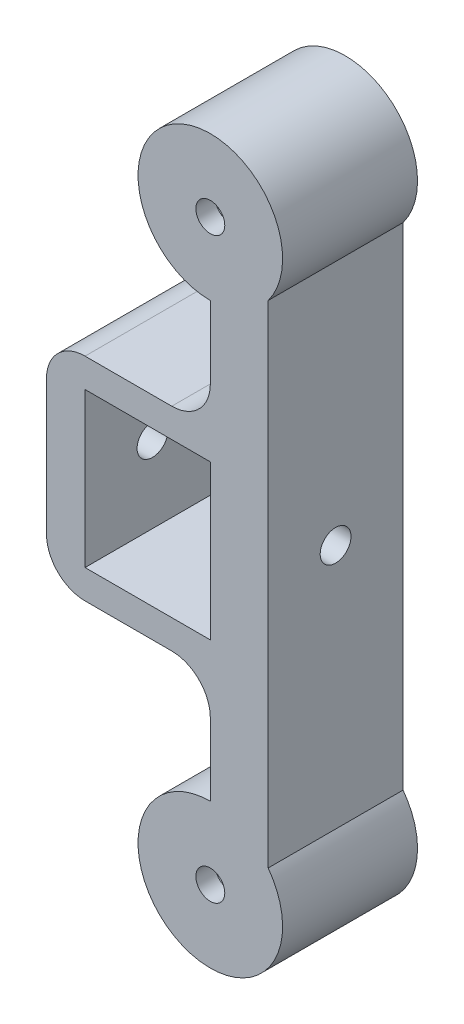
from build123d import *

# Parameters (mm, degrees)
ESBO_O1_R                  = 4
ESBO_O1_W                  = 13
ESBO_O1_H                  = 16
RESSALTO_EXTRUS_O1_DEPTH   = 14
RESSALTO_EXTRUS_O2_START   = -4
ESBO_O3_R                  = 1.5
RESSALTO_EXTRUS_O2_DEPTH   = 4
CORTE_EXTRUS_O1_DEPTH      = 72.001760542
CORTE_EXTRUS_O1_DEPTH_BACK = 72.001760542
ESBO_O2_R                  = 1.6
CORTE_EXTRUS_O2_START      = -2
CORTE_EXTRUS_O2_DEPTH      = 2
FILETE1_R                  = 4


with BuildPart() as part:
    # Esboço1 → Ressalto-extrusão1 (new body)
    with BuildSketch(Plane.XY):
        with BuildLine():
            Line((6, 55.5), (6, 4.5))
            ThreePointArc((6, 4.5), (-3.354101966, -6.708203932), (0, 7.5))
            Line((0, 7.5), (0, 19))
            Line((0, 19), (-17, 19))
            Line((-17, 19), (-17, 41))
            Line((-17, 41), (0, 41))
            Line((0, 41), (0, 52.5))
            ThreePointArc((0, 52.5), (-3.354101966, 66.708203932), (6, 55.5))
        make_face()
        with Locations((0, 60)):
            Circle(ESBO_O1_R, mode=Mode.SUBTRACT)
        Circle(ESBO_O1_R, mode=Mode.SUBTRACT)
        with Locations((-6.5, 30)):
            Rectangle(ESBO_O1_W, ESBO_O1_H, mode=Mode.SUBTRACT)
    extrude(amount=RESSALTO_EXTRUS_O1_DEPTH)

    # Esboço3 → Ressalto-extrusão2 (add)
    with BuildSketch(Plane.XY.offset(14).offset(RESSALTO_EXTRUS_O2_START)):
        with BuildLine():
            Line((0, 52.5), (0, 7.5))
            ThreePointArc((0, 7.5), (-3.354101966, -6.708203932), (6, 4.5))
            Line((6, 4.5), (6, 55.5))
            ThreePointArc((6, 55.5), (-3.354101966, 66.708203932), (0, 52.5))
        make_face()
        with Locations((0, 60)):
            Circle(ESBO_O3_R, mode=Mode.SUBTRACT)
        Circle(ESBO_O3_R, mode=Mode.SUBTRACT)
    extrude(amount=RESSALTO_EXTRUS_O2_DEPTH)

    # Esboço2 → Corte-extrusão1 (cut, two sides: drawn at the far end of the back side and taken through both)
    with BuildSketch(Plane.ZY.offset(-CORTE_EXTRUS_O1_DEPTH_BACK)):
        with Locations((7, 30)):
            Circle(ESBO_O2_R)
    extrude(amount=CORTE_EXTRUS_O1_DEPTH + CORTE_EXTRUS_O1_DEPTH_BACK, mode=Mode.SUBTRACT)

    # Esboço4 → Corte-extrusão2 (cut)
    with BuildSketch(Plane.XY.offset(14).offset(CORTE_EXTRUS_O2_START)):
        Polygon((0, 56.940043573), (2.65, 58.470021787), (2.65, 61.529978213), (0, 63.059956427), (-2.65, 61.529978213), (-2.65, 58.470021787), align=None)
        Polygon((0, -3.059956427), (2.65, -1.529978213), (2.65, 1.529978213), (0, 3.059956427), (-2.65, 1.529978213), (-2.65, -1.529978213), align=None)
    extrude(amount=-CORTE_EXTRUS_O2_DEPTH, mode=Mode.SUBTRACT)

    # Filete1
    filete1_edges = [part.edges().sort_by_distance(p)[0] for p in [
        (0, 41, 7),
        (0, 19, 7),
        (-17, 19, 7),
        (-17, 41, 7),
    ]]
    fillet(filete1_edges, radius=FILETE1_R)


solid = part.part
